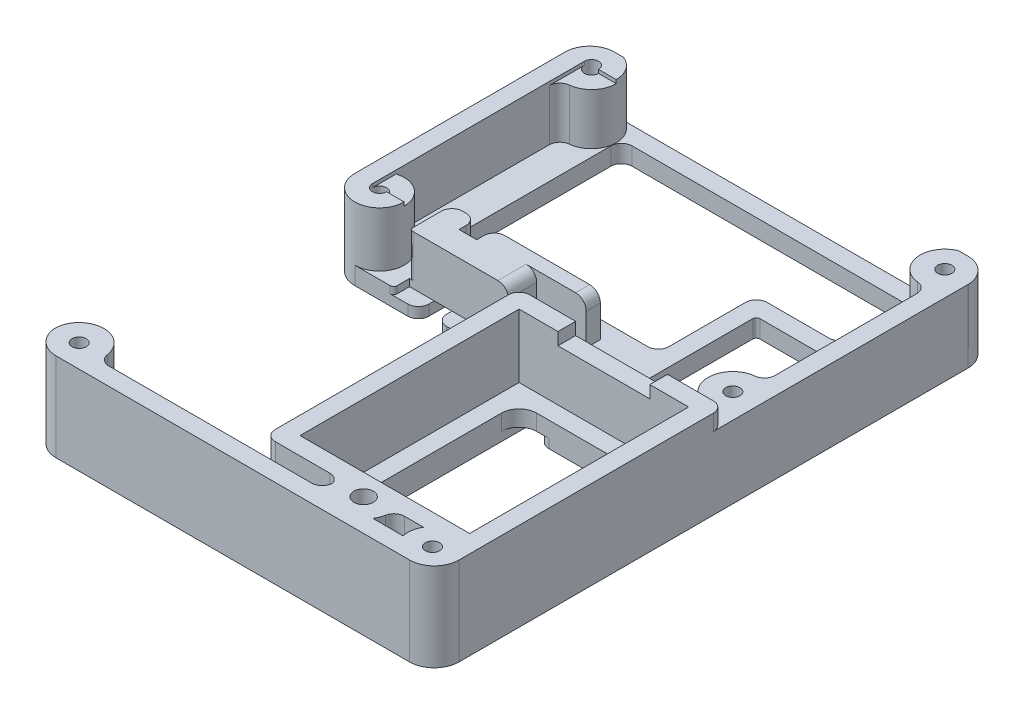
from build123d import *
from build123d.topology import SkipClean

# Parameters (mm, degrees)
BOSS_EXTRUDE1_DEPTH = 25
SKETCH5_W           = 48
SKETCH5_H           = 62
CUT_EXTRUDE3_DEPTH  = 18
SKETCH7_R           = 2
SKETCH7_R_2         = 2.75
CUT_EXTRUDE5_DEPTH  = 101.573356313
SHELL1_START        = 5
SHELL1_DEPTH        = 20
SKETCH10_W          = 26
SKETCH10_H          = 5
CUT_EXTRUDE7_DEPTH  = 3.5
SKETCH11_W          = 138.896745382
SKETCH11_H          = 78.644732545
CUT_EXTRUDE8_DEPTH  = 4.5
CUT_EXTRUDE13_START = -20
CUT_EXTRUDE13_DEPTH = 20
BOSS_EXTRUDE2_DEPTH = 12
FILLET2_R           = 3
CUT_EXTRUDE14_DEPTH = 5
FILLET3_R           = 3
SKETCH16_R          = 1.25
CUT_EXTRUDE16_DEPTH = 100.448479124
CUT_EXTRUDE20_DEPTH = 7
CUT_EXTRUDE21_DEPTH = 10
CUT_EXTRUDE22_START = -12
CUT_EXTRUDE22_DEPTH = 12
FILLET5_R           = 3
SKETCH25_W          = 9
SKETCH25_H          = 11.51587184
CUT_EXTRUDE24_DEPTH = 1
CUT_EXTRUDE25_DEPTH = 100.448479124
SKETCH29_W          = 43
SKETCH29_H          = 4.5
CUT_EXTRUDE28_DEPTH = 2
FILLET7_R           = 1
FILLET8_R           = 3
FILLET9_R           = 3
SKETCH27_W          = 25
SKETCH27_H          = 15
CUT_EXTRUDE26_DEPTH = 100.448479124
CUT_EXTRUDE27_DEPTH = 100.448479124
SKETCH30_W          = 5.41
SKETCH30_H          = 53.131398409
CUT_EXTRUDE29_DEPTH = 2.5
FILLET10_R          = 1
FILLET15_R          = 3
FILLET16_R          = 3
SKETCH31_W          = 25
SKETCH31_H          = 2
BOSS_EXTRUDE3_DEPTH = 3
FILLET17_R          = 3


with BuildPart() as part:
    # Sketch1 → Boss-Extrude1 (new body)
    with BuildSketch(Plane(origin=(0, 0, 0), x_dir=(1, 0, 0), z_dir=(0, 1, 0))):
        with BuildLine():
            Line((-50, 79), (50, 79))
            ThreePointArc((50, 79), (54.949747468, 76.949747468), (57, 72))
            Line((57, 72), (57, -72))
            ThreePointArc((57, -72), (54.949747468, -76.949747468), (50, -79))
            Line((50, -79), (-50, -79))
            ThreePointArc((-50, -79), (-54.949747468, -76.949747468), (-57, -72))
            Line((-57, -72), (-57, 72))
            ThreePointArc((-57, 72), (-54.949747468, 76.949747468), (-50, 79))
        make_face()
    extrude(amount=BOSS_EXTRUDE1_DEPTH)

    # Sketch5 → Cut-Extrude3 (cut)
    with BuildSketch(Plane(origin=(0, 25, 0), x_dir=(1, 0, 0), z_dir=(0, 1, 0))):
        with Locations((28, -33)):
            Rectangle(SKETCH5_W, SKETCH5_H)
    extrude(amount=-CUT_EXTRUDE3_DEPTH, mode=Mode.SUBTRACT)

    # Sketch7 → Cut-Extrude5 (cut, through all)
    with BuildSketch(Plane(origin=(0, 25, 0), x_dir=(1, 0, 0), z_dir=(0, 1, 0))):
        with Locations(Location((-50, 72.5, 0), (0, 0, 270))):
            Circle(SKETCH7_R)
        with Locations(Location((50, 72.5, 0), (0, 0, 270))):
            Circle(SKETCH7_R)
        with Locations(Location((-50, -72.5, 0), (0, 0, 270))):
            Circle(SKETCH7_R)
        with Locations(Location((50, -72.5, 0), (0, 0, 270))):
            Circle(SKETCH7_R)
        with Locations(Location((28, -70, 0), (0, 0, 270))):
            Circle(SKETCH7_R_2)
        with Locations(Location((-50, 12.5, 0), (0, 0, 270))):
            Circle(SKETCH7_R)
        with Locations(Location((50, 12.5, 0), (0, 0, 270))):
            Circle(SKETCH7_R)
    extrude(amount=-CUT_EXTRUDE5_DEPTH, mode=Mode.SUBTRACT)

    # Shell1: read off the stored shape, not the designer's step
    # Shell1 outline → Shell1 (cut)
    with BuildSketch(Plane(origin=(0, 0, 0), x_dir=(1, 0, 0), z_dir=(0, 1, 0)).offset(SHELL1_START)):
        with BuildLine():
            ThreePointArc((-56.982120022, 72), (-56.989944922, 72.124940024), (-56.99553429, 72.25))
            ThreePointArc((-56.99553429, 72.25), (-56.998883483, 72.125019941), (-57, 72))
            Line((-57, 72), (-56.982120022, 72))
        make_face()
        with BuildLine():
            ThreePointArc((57, 72), (56.998883483, 72.125019941), (56.99553429, 72.25))
            ThreePointArc((56.99553429, 72.25), (56.989944922, 72.124940024), (56.982120022, 72))
            Line((56.982120022, 72), (57, 72))
        make_face()
        with BuildLine():
            Line((52, 19.208203932), (52, 65.791796068))
            ThreePointArc((52, 65.791796068), (43.389131179, 70.198606198), (47.401923789, 79))
            Line((47.401923789, 79), (-47.401923789, 79))
            ThreePointArc((-47.401923789, 79), (-43.389131179, 70.198606198), (-52, 65.791796068))
            Line((-52, 65.791796068), (-52, 19.208203932))
            ThreePointArc((-52, 19.208203932), (-43, 12.5), (-52, 5.791796068))
            Line((-52, 5.791796068), (-52, -65.791796068))
            ThreePointArc((-52, -65.791796068), (-45.236203637, -67.371038681), (-43.162602834, -74))
            Line((-43.162602834, -74), (21.362040976, -74))
            ThreePointArc((21.362040976, -74), (20.414598578, -71.588768473), (20.314786926, -69))
            Line((20.314786926, -69), (-1, -69))
            Line((-1, -69), (-1, 3))
            Line((-1, 3), (52, 3))
            Line((52, 3), (52, 5.791796068))
            ThreePointArc((52, 5.791796068), (43, 12.5), (52, 19.208203932))
        make_face()
        with BuildLine():
            ThreePointArc((35.685213074, -69), (35.585401422, -71.588768473), (34.637959024, -74))
            Line((34.637959024, -74), (43.162602834, -74))
            ThreePointArc((43.162602834, -74), (43.082647996, -71.42750699), (43.937822174, -69))
            Line((43.937822174, -69), (35.685213074, -69))
        make_face()
    extrude(amount=SHELL1_DEPTH, mode=Mode.SUBTRACT)

    # Sketch10 → Cut-Extrude7 (cut)
    with BuildSketch(Plane(origin=(0, 25, 0), x_dir=(1, 0, 0), z_dir=(0, 1, 0))):
        with Locations((28, 0.5)):
            Rectangle(SKETCH10_W, SKETCH10_H)
    extrude(amount=-CUT_EXTRUDE7_DEPTH, mode=Mode.SUBTRACT)

    # Sketch11 → Cut-Extrude8 (cut)
    with BuildSketch(Plane(origin=(0, 25, 0), x_dir=(1, 0, 0), z_dir=(0, 1, 0))):
        with Locations((2.854042713, 42.322366273)):
            Rectangle(SKETCH11_W, SKETCH11_H)
    extrude(amount=-CUT_EXTRUDE8_DEPTH, mode=Mode.SUBTRACT)

    # Sketch12 → Cut-Extrude13 (cut)
    with BuildSketch(Plane(origin=(0, 25, 0), x_dir=(1, 0, 0), z_dir=(0, 1, 0)).offset(CUT_EXTRUDE13_START)):
        with BuildLine():
            Line((-52, 5.791796068), (-52, -65.791796068))
            ThreePointArc((-52, -65.791796068), (-55.53687717, -68.21712816), (-56.99553429, -72.25))
            Line((-56.99553429, -72.25), (-74.971112251, -72.25))
            Line((-74.971112251, -72.25), (-74.971112251, 12.5))
            Line((-74.971112251, 12.5), (-57, 12.5))
            ThreePointArc((-57, 12.5), (-55.61248608, 8.316699867), (-52, 5.791796068))
        make_face()
    extrude(amount=CUT_EXTRUDE13_DEPTH, mode=Mode.SUBTRACT)

    # Sketch13 → Boss-Extrude2 (add)
    with BuildSketch(Plane(origin=(0, 5, 0), x_dir=(1, 0, 0), z_dir=(0, 1, 0))):
        Polygon((-43.461651585, 10), (-11, 10), (-11, 18), (3, 18), (3, 22), (-52, 22), (-52, 19.208203932), align=None)
    extrude(amount=BOSS_EXTRUDE2_DEPTH)

    # Fillet2
    fillet2_edges = [part.edges().sort_by_distance(p)[0] for p in [
        (-52, 11, -22),
        (-11, 17, -14),
        (3, 17, -20),
    ]]
    fillet(fillet2_edges, radius=FILLET2_R)

    # Sketch14 → Cut-Extrude14 (cut)
    with BuildSketch(Plane.ZY.offset(27)):
        Polygon((-22, 17), (-17, 17), (-17, 3), (0, 3), (0, 0), (-22, 0), align=None)
    extrude(amount=CUT_EXTRUDE14_DEPTH, mode=Mode.SUBTRACT)

    # Fillet3
    # the kernel refuses this fillet: 3 mm, written as the material it adds along each edge
    with BuildSketch(Plane(origin=(20.314786926, -2.192755032, 69), x_dir=(-1, 0, 0), z_dir=(0, 1, 0))) as fillet3_piece_1_section:
        with BuildLine():
            CenterArc((2.877102013, 3), FILLET3_R, 190.722152411, 79.277847589)
            ThreePointArc((-0.070520802, 2.441860465), (0.061556997, 1.223726314), (0, 0))
            Line((0, 0), (2.877102013, 0))
        make_face()
    fillet3_piece_1 = extrude(amount=27.192755032, mode=Mode.PRIVATE)
    fillet3_piece_1 = split(fillet3_piece_1, bisect_by=Plane(origin=(20.314786926, 0, 69), z_dir=(0, 1, 0)), keep=Keep.TOP, mode=Mode.PRIVATE)
    add(fillet3_piece_1)
    with BuildSketch(Plane(origin=(21.362040976, -5.163570725, 74), x_dir=(-1, 0, 0), z_dir=(0, 1, 0))) as fillet3_piece_2_section:
        with BuildLine():
            CenterArc((4.06542829, -3), FILLET3_R, 90, 95.337556847)
            ThreePointArc((1.078436481, -3.279069767), (0.72410238, -1.578729285), (0, 0))
            Line((0, 0), (4.06542829, 0))
        make_face()
    fillet3_piece_2 = extrude(amount=30.163570725, mode=Mode.PRIVATE)
    fillet3_piece_2 = split(fillet3_piece_2, bisect_by=Plane(origin=(21.362040976, 0, 74), z_dir=(0, 1, 0)), keep=Keep.TOP, mode=Mode.PRIVATE)
    add(fillet3_piece_2)
    with BuildSketch(Plane(origin=(-43.162602834, -2.623657002, 74), x_dir=(0.03269028767670864, 0, -0.999465529716565), z_dir=(0, 1, 0))) as fillet3_piece_3_section:
        with BuildLine():
            CenterArc((3.098084405, -2.949762091), FILLET3_R, 100.500275837, 81.37307344)
            Line((0.099687816, -3.047832954), (0, 0))
            ThreePointArc((0, 0), (1.275681814, -0.117221788), (2.551363628, 0))
        make_face()
    fillet3_piece_3 = extrude(amount=27.623657002, mode=Mode.PRIVATE)
    fillet3_piece_3 = split(fillet3_piece_3, bisect_by=Plane(origin=(-43.162602834, 0, 74), z_dir=(0, 1, 0)), keep=Keep.TOP, mode=Mode.PRIVATE)
    add(fillet3_piece_3)
    with BuildSketch(Plane(origin=(-52, -3.104176097, -65.791796068), x_dir=(0, 0, 1), z_dir=(0, 1, 0))) as fillet3_piece_4_section:
        with BuildLine():
            CenterArc((3.241670439, 3), FILLET3_R, 185.739170475, 84.260829525)
            ThreePointArc((0.256708127, 2.7), (0.260370185, 1.337448292), (0, 0))
            Line((0, 0), (3.241670439, 0))
        make_face()
    fillet3_piece_4 = extrude(amount=23.604176097, mode=Mode.PRIVATE)
    fillet3_piece_4 = split(fillet3_piece_4, bisect_by=Plane(origin=(-52, 0, -65.791796068), z_dir=(0, 1, 0)), keep=Keep.TOP, mode=Mode.PRIVATE)
    add(fillet3_piece_4)
    with BuildSketch(Plane(origin=(52, -1.97949017, -5.791796068), x_dir=(-0.9953453132791709, 0, 0.09637275202664576), z_dir=(0, 1, 0))) as fillet3_piece_5_section:
        with BuildLine():
            CenterArc((3.264491914, 2.944167792), FILLET3_R, 183.159872141, 75.768913532)
            Line((0.26905307, 2.778801132), (0, 0))
            ThreePointArc((0, 0), (1.344202553, 0.130275151), (2.688405106, 0))
        make_face()
    fillet3_piece_5 = extrude(amount=22.47949017, mode=Mode.PRIVATE)
    fillet3_piece_5 = split(fillet3_piece_5, bisect_by=Plane(origin=(52, 0, -5.791796068), z_dir=(0, 1, 0)), keep=Keep.TOP, mode=Mode.PRIVATE)
    add(fillet3_piece_5)
    with BuildSketch(Plane(origin=(52, -3.104176097, -19.208203932), x_dir=(0, 0, -1), z_dir=(0, 1, 0))) as fillet3_piece_6_section:
        with BuildLine():
            CenterArc((3.241670439, 3), FILLET3_R, 185.739170475, 84.260829525)
            ThreePointArc((0.256708127, 2.7), (0.260370185, 1.337448292), (0, 0))
            Line((0, 0), (3.241670439, 0))
        make_face()
    fillet3_piece_6 = extrude(amount=23.604176097, mode=Mode.PRIVATE)
    fillet3_piece_6 = split(fillet3_piece_6, bisect_by=Plane(origin=(52, 0, -19.208203932), z_dir=(0, 1, 0)), keep=Keep.TOP, mode=Mode.PRIVATE)
    add(fillet3_piece_6)
    with BuildSketch(Plane(origin=(52, -3.104176097, -65.791796068), x_dir=(-0.9955105882426797, 0, 0.09465024403937942), z_dir=(0, 1, 0))) as fillet3_piece_7_section:
        with BuildLine():
            CenterArc((3.293356663, 2.943166513), FILLET3_R, 174.568810436, 84.260829525)
            Line((0.306824898, 3.227117245), (0, 0))
            ThreePointArc((0, 0), (1.356088038, 0.132611469), (2.712176075, 0))
        make_face()
    fillet3_piece_7 = extrude(amount=23.604176097, mode=Mode.PRIVATE)
    fillet3_piece_7 = split(fillet3_piece_7, bisect_by=Plane(origin=(52, 0, -65.791796068), z_dir=(0, 1, 0)), keep=Keep.TOP, mode=Mode.PRIVATE)
    add(fillet3_piece_7)
    # the kernel refuses this fillet: 3 mm, written as the material it takes off along each edge
    with BuildSketch(Plane(origin=(-32, 5, -22), x_dir=(0, 0, 1), z_dir=(0, 1, 0))) as fillet3_2_piece_1:
        with BuildLine():
            CenterArc((FILLET3_R, -FILLET3_R), FILLET3_R, 90, 90)
            Line((0, -FILLET3_R), (0, 0))
            Line((0, 0), (FILLET3_R, 0))
        make_face()
    extrude(amount=19.5, mode=Mode.SUBTRACT)
    with BuildSketch(Plane(origin=(-27, 5, -22), x_dir=(0, 0, 1), z_dir=(0, 1, 0))) as fillet3_2_piece_2:
        with BuildLine():
            CenterArc((FILLET3_R, FILLET3_R), FILLET3_R, 180, 90)
            Line((0, FILLET3_R), (0, 0))
            Line((0, 0), (FILLET3_R, 0))
        make_face()
    extrude(amount=19.5, mode=Mode.SUBTRACT)

    # Sketch16 → Cut-Extrude16 (cut, through all)
    with BuildSketch(Plane(origin=(0, 5, 0), x_dir=(1, 0, 0), z_dir=(0, 1, 0))):
        with Locations(Location((-53.08, -9.93, 0), (0, 0, 270))):
            Circle(SKETCH16_R)
        with Locations(Location((-4.82, -11.2, 0), (0, 0, 270))):
            Circle(SKETCH16_R)
        with Locations(Location((-20.06, -62, 0), (0, 0, 270))):
            Circle(SKETCH16_R)
        with Locations(Location((-48, -62, 0), (0, 0, 270))):
            Circle(SKETCH16_R)
    extrude(amount=-CUT_EXTRUDE16_DEPTH, mode=Mode.SUBTRACT)

    # Sketch20 → Cut-Extrude20 (cut)
    with BuildSketch(Plane(origin=(0, 7, 0), x_dir=(1, 0, 0), z_dir=(0, 1, 0))):
        with BuildLine():
            Line((14, -7), (42, -7))
            ThreePointArc((42, -7), (45.535533906, -8.464466094), (47, -12))
            Line((47, -12), (47, -54))
            ThreePointArc((47, -54), (45.535533906, -57.535533906), (42, -59))
            Line((42, -59), (14, -59))
            ThreePointArc((14, -59), (10.464466094, -57.535533906), (9, -54))
            Line((9, -54), (9, -12))
            ThreePointArc((9, -12), (10.464466094, -8.464466094), (14, -7))
        make_face()
    extrude(amount=-CUT_EXTRUDE20_DEPTH, mode=Mode.SUBTRACT)

    # Sketch21 → Cut-Extrude21 (cut)
    with BuildSketch(Plane.XZ):
        Polygon((-47, 74.232050808), (-50, 75.964101615), (-53, 74.232050808), (-53, 70.767949192), (-50, 69.035898385), (-47, 70.767949192), align=None)
        Polygon((47, 74.232050808), (47, 70.767949192), (50, 69.035898385), (53, 70.767949192), (53, 74.232050808), (50, 75.964101615), align=None)
        Polygon((-47, -10.767949192), (-50, -9.035898385), (-53, -10.767949192), (-53, -14.232050808), (-50, -15.964101615), (-47, -14.232050808), align=None)
        Polygon((47, -10.767949192), (47, -14.232050808), (50, -15.964101615), (53, -14.232050808), (53, -10.767949192), (50, -9.035898385), align=None)
        Polygon((47, -70.767949192), (47, -74.232050808), (50, -75.964101615), (53, -74.232050808), (53, -70.767949192), (50, -69.035898385), align=None)
        Polygon((-53, -70.767949192), (-53, -74.232050808), (-50, -75.964101615), (-47, -74.232050808), (-47, -70.767949192), (-50, -69.035898385), align=None)
        Polygon((23.381197846, 70), (25.690598923, 66), (30.309401077, 66), (32.618802154, 70), (30.309401077, 74), (25.690598923, 74), align=None)
    extrude(amount=-CUT_EXTRUDE21_DEPTH, mode=Mode.SUBTRACT)

    # Sketch22 → Cut-Extrude22 (cut)
    with BuildSketch(Plane(origin=(0, 17, 0), x_dir=(1, 0, 0), z_dir=(0, 1, 0)).offset(CUT_EXTRUDE22_START)):
        with BuildLine():
            Line((-49, 22), (-39, 22))
            Line((-39, 22), (-39, 10))
            Line((-39, 10), (-43.461651585, 10))
            ThreePointArc((-43.461651585, 10), (-44.867076223, 17.259526605), (-52, 19.208203932))
            Line((-52, 19.208203932), (-52, 27.223754806))
            Line((-52, 27.223754806), (-49, 27.223754806))
            Line((-49, 27.223754806), (-49, 22))
        make_face()
    extrude(amount=CUT_EXTRUDE22_DEPTH, mode=Mode.SUBTRACT)

    # Fillet5
    fillet5_edges = [part.edges().sort_by_distance(p)[0] for p in [
        (-39, 11, -22),
    ]]
    fillet(fillet5_edges, radius=FILLET5_R)

    # Sketch25 → Cut-Extrude24 (cut)
    with BuildSketch(Plane(origin=(0, 20.5, 0), x_dir=(1, 0, 0), z_dir=(0, 1, 0))):
        with Locations((-47.5, 66.74206408)):
            Rectangle(SKETCH25_W, SKETCH25_H)
        with Locations((-47.5, 18.25793592)):
            Rectangle(SKETCH25_W, SKETCH25_H)
    extrude(amount=-CUT_EXTRUDE24_DEPTH, mode=Mode.SUBTRACT)

    # Sketch26 → Cut-Extrude25 (cut, through all)
    with SkipClean():  # the faces are left unmerged after this step: merging them gives an invalid solid
        with BuildSketch(Plane(origin=(0, 5, 0), x_dir=(1, 0, 0), z_dir=(0, 1, 0))):
            with BuildLine():
                Line((-50.401741496, -65.511537811), (-1, -65.511537811))
                Line((-1, -65.511537811), (-1, 5.5))
                Line((-1, 5.5), (-50, 5.5))
                ThreePointArc((-50, 5.5), (-54.949747468, 7.550252532), (-57, 12.5))
                Line((-57, 12.5), (-62, 12.5))
                Line((-62, 12.5), (-62, -72.25))
                Line((-62, -72.25), (-56.99553429, -72.25))
                ThreePointArc((-56.99553429, -72.25), (-55.003163043, -67.604250868), (-50.401741496, -65.511537811))
            make_face()
        extrude(amount=-CUT_EXTRUDE25_DEPTH, mode=Mode.SUBTRACT)

    # Sketch29 → Cut-Extrude28 (cut)
    with SkipClean():  # the faces are left unmerged after this step: merging them gives an invalid solid
        with BuildSketch(Plane(origin=(0, 5, 0), x_dir=(1, 0, 0), z_dir=(0, 1, 0))):
            with Locations((-17.5, 7.75)):
                Rectangle(SKETCH29_W, SKETCH29_H)
        extrude(amount=-CUT_EXTRUDE28_DEPTH, mode=Mode.SUBTRACT)

    # Fillet7
    # the kernel refuses this fillet: 1 mm, written as the material it adds along each edge
    with BuildSketch(Plane(origin=(-1, 3, -5.5), x_dir=(0, 0, 1), z_dir=(0, -1, 0))) as fillet7_piece_1:
        with BuildLine():
            CenterArc((FILLET7_R, FILLET7_R), FILLET7_R, 180, 90)
            Line((0, FILLET7_R), (0, 0))
            Line((0, 0), (FILLET7_R, 0))
        make_face()
    extrude(amount=3)
    with BuildSketch(Plane(origin=(-1, 5, 65.511537811), x_dir=(0, 0, -1), z_dir=(0, -1, 0))) as fillet7_piece_2:
        with BuildLine():
            CenterArc((FILLET7_R, -FILLET7_R), FILLET7_R, 90, 90)
            Line((0, -FILLET7_R), (0, 0))
            Line((0, 0), (FILLET7_R, 0))
        make_face()
    extrude(amount=5)

    # Fillet8
    fillet8_edges = [part.edges().sort_by_distance(p)[0] for p in [
        (-27, 1.5, -5.5),
        (-32, 1.5, -5.5),
    ]]
    fillet(fillet8_edges, radius=FILLET8_R)

    # Fillet9
    fillet9_edges = [part.edges().sort_by_distance(p)[0] for p in [
        (57, 22.75, -3),
        (-1, 15, -3),
        (-1, 15, 69),
        (35.685213074, 15, 69),
    ]]
    fillet(fillet9_edges, radius=FILLET9_R)

    # Sketch27 → Cut-Extrude26 (cut, through all)
    with BuildSketch(Plane(origin=(0, 5, 0), x_dir=(1, 0, 0), z_dir=(0, 1, 0))):
        with Locations((-27.5, 57.5)):
            Rectangle(SKETCH27_W, SKETCH27_H)
        Polygon((19.41, 49.734138399), (43, 49.734138399), (43, 52.734138399), (52, 52.734138399), (52, 22.449874371), (43, 22.449874371), (43, 10.174138399), (39.685, 10.174138399), (39.685, 3), (22.725, 3), (22.725, 10.174138399), (19.41, 10.174138399), align=None)
    extrude(amount=-CUT_EXTRUDE26_DEPTH, mode=Mode.SUBTRACT)

    # Sketch28 → Cut-Extrude27 (cut, through all)
    with BuildSketch(Plane(origin=(0, 5, 0), x_dir=(1, 0, 0), z_dir=(0, 1, 0))):
        Polygon((-43, 27), (14.41, 27), (14.41, 54.734138399), (38, 54.734138399), (38, 57.734138399), (43, 57.734138399), (43, 74), (-43, 74), align=None)
    extrude(amount=-CUT_EXTRUDE27_DEPTH, mode=Mode.SUBTRACT)

    # Sketch30 → Cut-Extrude29 (cut)
    with BuildSketch(Plane.XZ):
        with Locations((11.705, -9.445390335)):
            Rectangle(SKETCH30_W, SKETCH30_H)
    extrude(amount=-CUT_EXTRUDE29_DEPTH, mode=Mode.SUBTRACT)

    # Fillet10
    # the kernel refuses this fillet: 1 mm, written as the material it adds along each edge
    with BuildSketch(Plane(origin=(43, 5, -10.174138399), x_dir=(-1, 0, 0), z_dir=(0, -1, 0)), Plane(origin=(19.41, 5, -10.174138399), x_dir=(0, 0, -1), z_dir=(0, -1, 0)), Plane(origin=(39.685, 5, -3), x_dir=(-1, 0, 0), z_dir=(0, -1, 0))) as fillet10_piece_1:
        with BuildLine():
            CenterArc((FILLET10_R, FILLET10_R), FILLET10_R, 180, 90)
            Line((0, FILLET10_R), (0, 0))
            Line((0, 0), (FILLET10_R, 0))
        make_face()
    extrude(amount=5)
    with BuildSketch(Plane(origin=(19.41, 5, -49.734138399), x_dir=(0, 0, 1), z_dir=(0, -1, 0)), Plane(origin=(22.725, 5, -3), x_dir=(1, 0, 0), z_dir=(0, -1, 0)), Plane(origin=(52, 5, -22.449874371), x_dir=(0, 0, -1), z_dir=(0, -1, 0)), Plane(origin=(52, 5, -52.734138399), x_dir=(-1, 0, 0), z_dir=(0, -1, 0)), Plane(origin=(43, 5, -52.734138399), x_dir=(0, 0, 1), z_dir=(0, -1, 0))) as fillet10_piece_2:
        with BuildLine():
            CenterArc((FILLET10_R, -FILLET10_R), FILLET10_R, 90, 90)
            Line((0, -FILLET10_R), (0, 0))
            Line((0, 0), (FILLET10_R, 0))
        make_face()
    extrude(amount=5)
    with BuildSketch(Plane(origin=(4, 5, -5.5), x_dir=(-1, 0, 0), z_dir=(0, -1, 0)), Plane(origin=(4, 5, -10), x_dir=(0, 0, 1), z_dir=(0, -1, 0))) as fillet10_piece_3:
        with BuildLine():
            CenterArc((FILLET10_R, FILLET10_R), FILLET10_R, 180, 90)
            Line((0, FILLET10_R), (0, 0))
            Line((0, 0), (FILLET10_R, 0))
        make_face()
    extrude(amount=4.5)
    # the kernel refuses this fillet: 1 mm, written as the material it takes off along each edge
    with BuildSketch(Plane(origin=(39.685, 7.5, -10.174138399), x_dir=(1, 0, 0), z_dir=(0, -1, 0)), Plane(origin=(43, 7.5, -22.449874371), x_dir=(1, 0, 0), z_dir=(0, -1, 0))) as fillet10_2_piece_1:
        with BuildLine():
            CenterArc((FILLET10_R, FILLET10_R), FILLET10_R, 180, 90)
            Line((0, FILLET10_R), (0, 0))
            Line((0, 0), (FILLET10_R, 0))
        make_face()
    extrude(amount=10, mode=Mode.SUBTRACT)
    with BuildSketch(Plane(origin=(22.725, 7.5, -10.174138399), x_dir=(-1, 0, 0), z_dir=(0, -1, 0)), Plane(origin=(43, 7.5, -49.734138399), x_dir=(0, 0, -1), z_dir=(0, -1, 0))) as fillet10_2_piece_2:
        with BuildLine():
            CenterArc((FILLET10_R, -FILLET10_R), FILLET10_R, 90, 90)
            Line((0, -FILLET10_R), (0, 0))
            Line((0, 0), (FILLET10_R, 0))
        make_face()
    extrude(amount=10, mode=Mode.SUBTRACT)
    with BuildSketch(Plane(origin=(-39, 7.5, -5.5), x_dir=(-1, 0, 0), z_dir=(0, -1, 0))) as fillet10_2_piece_3:
        with BuildLine():
            CenterArc((FILLET10_R, FILLET10_R), FILLET10_R, 180, 90)
            Line((0, FILLET10_R), (0, 0))
            Line((0, 0), (FILLET10_R, 0))
        make_face()
    extrude(amount=4.5, mode=Mode.SUBTRACT)
    with BuildSketch(Plane(origin=(-1, 7.5, -5.5), x_dir=(0, 0, 1), z_dir=(0, -1, 0))) as fillet10_2_piece_4:
        with BuildLine():
            CenterArc((FILLET10_R, -FILLET10_R), FILLET10_R, 90, 90)
            Line((0, -FILLET10_R), (0, 0))
            Line((0, 0), (FILLET10_R, 0))
        make_face()
    extrude(amount=4.5, mode=Mode.SUBTRACT)
    with BuildSketch(Plane(origin=(-39, 5, -10), x_dir=(1, 0, 0), z_dir=(0, 1, 0))) as fillet10_2_piece_5:
        with BuildLine():
            CenterArc((FILLET10_R, FILLET10_R), FILLET10_R, 180, 90)
            Line((0, FILLET10_R), (0, 0))
            Line((0, 0), (FILLET10_R, 0))
        make_face()
    extrude(amount=14.5, mode=Mode.SUBTRACT)

    # Fillet15
    # the kernel refuses this fillet: 3 mm, written as the material it adds along each edge
    with BuildSketch(Plane(origin=(43, 5, -57.734138399), x_dir=(-1, 0, 0), z_dir=(0, -1, 0)), Plane(origin=(-43, 5, -27), x_dir=(0, 0, -1), z_dir=(0, -1, 0)), Plane(origin=(43, 5, -74), x_dir=(0, 0, 1), z_dir=(0, -1, 0)), Plane(origin=(38, 5, -54.734138399), x_dir=(-1, 0, 0), z_dir=(0, -1, 0))) as fillet15_piece_1:
        with BuildLine():
            CenterArc((FILLET15_R, FILLET15_R), FILLET15_R, 180, 90)
            Line((0, FILLET15_R), (0, 0))
            Line((0, 0), (FILLET15_R, 0))
        make_face()
    extrude(amount=5)
    with BuildSketch(Plane(origin=(14.41, 5, -27), x_dir=(-1, 0, 0), z_dir=(0, -1, 0))) as fillet15_piece_2:
        with BuildLine():
            CenterArc((FILLET15_R, FILLET15_R), FILLET15_R, 180, 90)
            Line((0, FILLET15_R), (0, 0))
            Line((0, 0), (FILLET15_R, 0))
        make_face()
    extrude(amount=2.5)
    with BuildSketch(Plane(origin=(-43, 5, -74), x_dir=(0, 0, 1), z_dir=(0, -1, 0))) as fillet15_piece_3:
        with BuildLine():
            CenterArc((FILLET15_R, -FILLET15_R), FILLET15_R, 90, 90)
            Line((0, -FILLET15_R), (0, 0))
            Line((0, 0), (FILLET15_R, 0))
        make_face()
    extrude(amount=5)
    # the kernel refuses this fillet: 3 mm, written as the material it takes off along each edge
    with BuildSketch(Plane(origin=(14.41, 2.5, 7), x_dir=(0, 0, -1), z_dir=(0, -1, 0)), Plane(origin=(9, -7.5, -27), x_dir=(-1, 0, 0), z_dir=(0, 1, 0))) as fillet15_2_piece_1:
        with BuildLine():
            CenterArc((FILLET15_R, FILLET15_R), FILLET15_R, 180, 90)
            Line((0, FILLET15_R), (0, 0))
            Line((0, 0), (FILLET15_R, 0))
        make_face()
    extrude(amount=10, mode=Mode.SUBTRACT)
    with BuildSketch(Plane(origin=(14.41, 12.5, -54.734138399), x_dir=(0, 0, 1), z_dir=(0, -1, 0))) as fillet15_2_piece_2:
        with BuildLine():
            CenterArc((FILLET15_R, -FILLET15_R), FILLET15_R, 90, 90)
            Line((0, -FILLET15_R), (0, 0))
            Line((0, 0), (FILLET15_R, 0))
        make_face()
    extrude(amount=20, mode=Mode.SUBTRACT)

    # Fillet16
    fillet16_edges = [part.edges().sort_by_distance(p)[0] for p in [
        (38, 2.5, -57.734138399),
    ]]
    fillet(fillet16_edges, radius=FILLET16_R)

    # Sketch31 → Boss-Extrude3 (add)
    with BuildSketch(Plane(origin=(0, 0, 65.511537811), x_dir=(-1, 0, 0), z_dir=(0, 0, -1))):
        with Locations((23.5, 4)):
            Rectangle(SKETCH31_W, SKETCH31_H)
    extrude(amount=BOSS_EXTRUDE3_DEPTH)

    # Fillet17
    fillet17_edges = [part.edges().sort_by_distance(p)[0] for p in [
        (-11, 4, 62.511537811),
        (-36, 4, 62.511537811),
    ]]
    fillet(fillet17_edges, radius=FILLET17_R - 0.0001)  # a hair under: the kernel refuses the full size


solid = part.part
